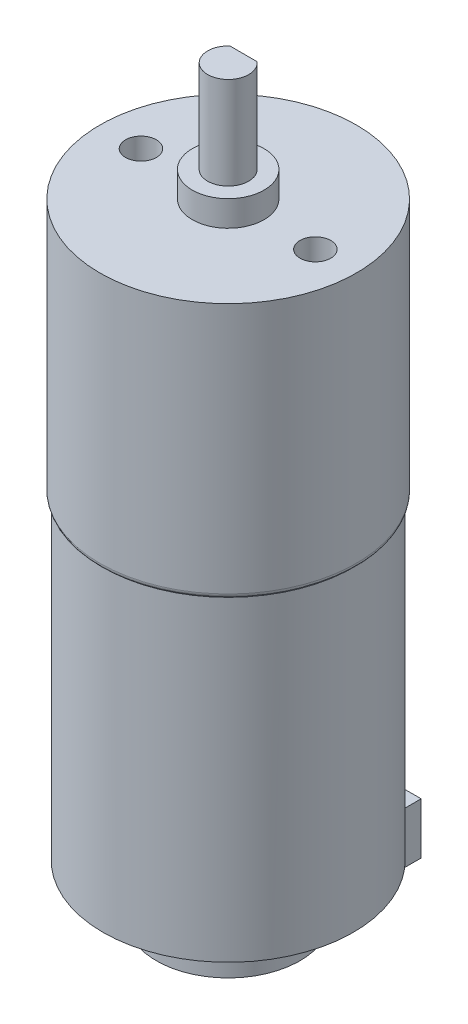
from build123d import *

# Parameters (mm, degrees)
SKETCH1_R           = 12.5
BOSS_EXTRUDE1_DEPTH = 25
FILLET1_R           = 0.5
SKETCH3_R           = 12.2
BOSS_EXTRUDE2_DEPTH = 30.8
SKETCH4_R           = 3.5
BOSS_EXTRUDE3_DEPTH = 2.5
SKETCH5_R           = 2
BOSS_EXTRUDE4_DEPTH = 9
CUT_EXTRUDE1_START  = -8
CUT_EXTRUDE1_DEPTH  = 8
SKETCH7_R           = 1.5
CUT_EXTRUDE2_DEPTH  = 5
SKETCH8_R           = 7
SKETCH8_W           = 8.453145494
SKETCH8_H           = 4.159745146
BOSS_EXTRUDE5_DEPTH = 5


with BuildPart() as part:
    # Sketch1 → Boss-Extrude1 (new body)
    with BuildSketch(Plane(origin=(0, 0, 0), x_dir=(1, 0, 0), z_dir=(0, 1, 0))):
        Circle(SKETCH1_R)
    extrude(amount=BOSS_EXTRUDE1_DEPTH)

    # Fillet1
    fillet1_edges = [part.edges().sort_by_distance(p)[0] for p in [
        (-12.5, 0, 0),
    ]]
    fillet(fillet1_edges, radius=FILLET1_R)

    # Sketch3 → Boss-Extrude2 (add)
    with BuildSketch(Plane.XZ):
        Circle(SKETCH3_R)
    extrude(amount=BOSS_EXTRUDE2_DEPTH)

    # Sketch4 → Boss-Extrude3 (add)
    with BuildSketch(Plane(origin=(0, 25, 0), x_dir=(1, 0, 0), z_dir=(0, 1, 0))):
        Circle(SKETCH4_R)
    extrude(amount=BOSS_EXTRUDE3_DEPTH)

    # Sketch5 → Boss-Extrude4 (add)
    with BuildSketch(Plane(origin=(0, 27.5, 0), x_dir=(1, 0, 0), z_dir=(0, 1, 0))):
        Circle(SKETCH5_R)
    extrude(amount=BOSS_EXTRUDE4_DEPTH)

    # Sketch6 → Cut-Extrude1 (cut)
    with BuildSketch(Plane(origin=(0, 36.5, 0), x_dir=(1, 0, 0), z_dir=(0, 1, 0)).offset(CUT_EXTRUDE1_START)):
        with BuildLine():
            Line((1.322875656, 1.5), (-1.322875656, 1.5))
            ThreePointArc((-1.322875656, 1.5), (0, 2), (1.322875656, 1.5))
        make_face()
    extrude(amount=CUT_EXTRUDE1_DEPTH, mode=Mode.SUBTRACT)

    # Sketch7 → Cut-Extrude2 (cut)
    with BuildSketch(Plane(origin=(0, 25, 0), x_dir=(1, 0, 0), z_dir=(0, 1, 0))):
        with Locations((-8.5, 0)):
            Circle(SKETCH7_R)
        with Locations((8.5, 0)):
            Circle(SKETCH7_R)
    extrude(amount=-CUT_EXTRUDE2_DEPTH, mode=Mode.SUBTRACT)

    # Sketch8 → Boss-Extrude5 (add)
    with BuildSketch(Plane.XZ.offset(30.8)):
        Circle(SKETCH8_R)
        with Locations((0, -12.5)):
            Rectangle(SKETCH8_W, SKETCH8_H)
    extrude(amount=BOSS_EXTRUDE5_DEPTH)


solid = part.part
